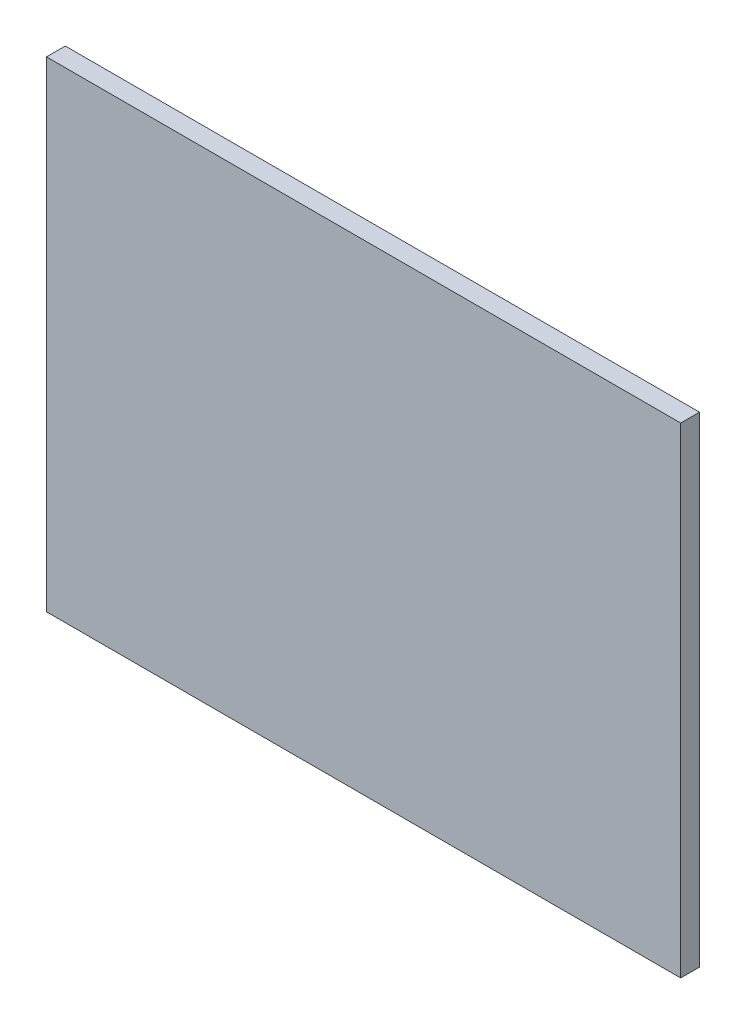
from build123d import *

# Parameters (mm, degrees)
SKETCH1_W          = 64
SKETCH1_H          = 48.5
BASE_FLANGE1_DEPTH = 1.89738


# Sheet-metal steps are written as plain solids
with BuildPart() as part:
    # Sketch1 → Base-Flange1 (new body)
    with BuildSketch(Plane.XY):
        with Locations((-16.85548419, -2.621372257)):
            Rectangle(SKETCH1_W, SKETCH1_H)
    extrude(amount=-BASE_FLANGE1_DEPTH)


solid = part.part
